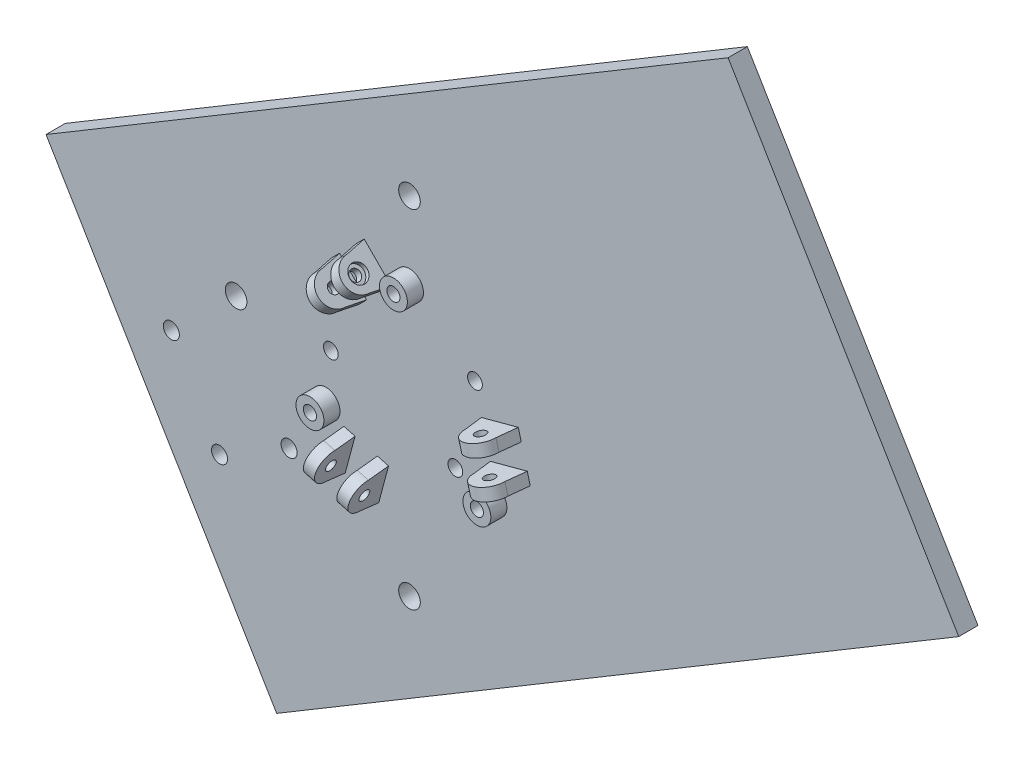
from build123d import *

# Parameters (mm, degrees)
F_01_START                                    = -12
S01_ROUNDED_V3_BACKPLATE_WITH_CAGE_AND_R      = 3.365102548
S01_ROUNDED_V3_BACKPLATE_WITH_CAGE_AND_R_2    = 2.294388101
F_01_ROUNDED_V3_BACKPLATE_WITH_CAGE_AND_DEPTH = 6
F_02_START                                    = -6
S02_THREE_CORD_GUIDE_PEDESTALS_R              = 4.35
F_02_THREE_CORD_GUIDE_PEDESTALS_DEPTH         = 5
F_03_START                                    = -13
S03_THREE_SMOOTH_GROMMET_SEATS_R              = 2.05
F_03_THREE_SMOOTH_GROMMET_SEATS_DEPTH         = 14
F_04_START                                    = -7.2
F_04_INTEGRAL_A1_FORK_CHEEK_L_DEPTH           = 3.6
F_05_START                                    = 3.6
F_05_INTEGRAL_A1_FORK_CHEEK_R_DEPTH           = 3.6
F_06_START                                    = -7.5
S06_A1_PIVOT_THROUGH_BOTH_CHEEKS_R            = 1.65
F_06_A1_PIVOT_THROUGH_BOTH_CHEEKS_DEPTH       = 15
F_07_START                                    = -7.3
S07_A1_RECESSED_PIVOT_SCREW_HEAD_R            = 2.7
F_07_A1_RECESSED_PIVOT_SCREW_HEAD_DEPTH       = 1.5
F_08_START                                    = -7.2
F_08_INTEGRAL_A2_FORK_CHEEK_L_DEPTH           = 3.6
F_09_START                                    = 3.6
F_09_INTEGRAL_A2_FORK_CHEEK_R_DEPTH           = 3.6
F_10_START                                    = -7.5
S10_A2_PIVOT_THROUGH_BOTH_CHEEKS_R            = 1.65
F_10_A2_PIVOT_THROUGH_BOTH_CHEEKS_DEPTH       = 15
F_11_START                                    = -7.3
S11_A2_RECESSED_PIVOT_SCREW_HEAD_R            = 2.7
F_11_A2_RECESSED_PIVOT_SCREW_HEAD_DEPTH       = 1.5
F_12_START                                    = -7.2
F_12_INTEGRAL_A3_FORK_CHEEK_L_DEPTH           = 3.6
F_13_START                                    = 3.6
F_13_INTEGRAL_A3_FORK_CHEEK_R_DEPTH           = 3.6
F_14_START                                    = -7.5
S14_A3_PIVOT_THROUGH_BOTH_CHEEKS_R            = 1.65
F_14_A3_PIVOT_THROUGH_BOTH_CHEEKS_DEPTH       = 15
F_15_START                                    = -7.3
S15_A3_RECESSED_PIVOT_SCREW_HEAD_R            = 2.7
F_15_A3_RECESSED_PIVOT_SCREW_HEAD_DEPTH       = 1.5
BOSS_EXTRUDE1_DEPTH                           = 20
CUT_EXTRUDE1_DEPTH                            = 235.034793049
CUT_EXTRUDE1_DEPTH_BACK                       = 235.034793049
SKETCH2_R                                     = 2.2
FILLET1_R                                     = 2
BOSS_EXTRUDE2_DEPTH                           = 10
CUT_EXTRUDE3_DEPTH                            = 224.142474253
CUT_EXTRUDE3_DEPTH_BACK                       = 224.142474253
SKETCH4_R                                     = 2.5


with BuildPart() as part:
    # S01 - Rounded V3 backplate with cage and cassette fixings → 01 - Rounded V3 backplate with cage and cassette fixings (new body)
    with BuildSketch(Plane.XY.offset(F_01_START)):
        Polygon((-113.163433478, 13.929728046), (41.356735424, 106.252625544), (99.189614728, 140.806684253), (170.996312782, 20.624330663), (113.163433478, -13.929728046), (-41.356735424, -106.252625544), align=None)
        with Locations((0, 54)):
            Circle(S01_ROUNDED_V3_BACKPLATE_WITH_CAGE_AND_R, mode=Mode.SUBTRACT)
        with Locations((-53.973473076, 0)):
            Circle(S01_ROUNDED_V3_BACKPLATE_WITH_CAGE_AND_R, mode=Mode.SUBTRACT)
        with Locations((0, -54)):
            Circle(S01_ROUNDED_V3_BACKPLATE_WITH_CAGE_AND_R, mode=Mode.SUBTRACT)
        with Locations((14.276192628, -12.236736538)):
            Circle(S01_ROUNDED_V3_BACKPLATE_WITH_CAGE_AND_R_2, mode=Mode.SUBTRACT)
        with Locations((20.394560897, 14.276192628)):
            Circle(S01_ROUNDED_V3_BACKPLATE_WITH_CAGE_AND_R_2, mode=Mode.SUBTRACT)
        with Locations((-24.473473076, 0)):
            Circle(S01_ROUNDED_V3_BACKPLATE_WITH_CAGE_AND_R_2, mode=Mode.SUBTRACT)
    extrude(amount=F_01_ROUNDED_V3_BACKPLATE_WITH_CAGE_AND_DEPTH)

    # S02 - Three cord guide pedestals → 02 - Three cord guide pedestals (add)
    with BuildSketch(Plane.XY.offset(F_02_START)):
        with Locations((25.980762114, -15)):
            Circle(S02_THREE_CORD_GUIDE_PEDESTALS_R)
        with Locations((0, 30)):
            Circle(S02_THREE_CORD_GUIDE_PEDESTALS_R)
        with Locations((-25.980762114, -15)):
            Circle(S02_THREE_CORD_GUIDE_PEDESTALS_R)
    extrude(amount=F_02_THREE_CORD_GUIDE_PEDESTALS_DEPTH)

    # S03 - Three smooth grommet seats → 03 - Three smooth grommet seats (cut)
    with BuildSketch(Plane.XY.offset(F_03_START)):
        with Locations((25.980762114, -15)):
            Circle(S03_THREE_SMOOTH_GROMMET_SEATS_R)
        with Locations((0, 30)):
            Circle(S03_THREE_SMOOTH_GROMMET_SEATS_R)
        with Locations((-25.980762114, -15)):
            Circle(S03_THREE_SMOOTH_GROMMET_SEATS_R)
    extrude(amount=F_03_THREE_SMOOTH_GROMMET_SEATS_DEPTH, mode=Mode.SUBTRACT)

    # S04 - Integral A1 fork cheek L → 04 - Integral A1 fork cheek L (add)
    with BuildSketch(Plane(origin=(2.009618943, -7.5, 0), x_dir=(0.9659258262890683, 0.25881904510252085, 0), z_dir=(-0.2588190451025208, 0.9659258262890682, 0)).offset(F_04_START)):
        with BuildLine():
            Line((35.077774789, 7), (22.877774789, 7))
            Line((22.877774789, 7), (24.027774789, 0))
            ThreePointArc((24.027774789, 0), (28.977774789, -4.95), (33.927774789, 0))
            Line((33.927774789, 0), (35.077774789, 7))
        make_face()
    extrude(amount=F_04_INTEGRAL_A1_FORK_CHEEK_L_DEPTH)

    # S05 - Integral A1 fork cheek R → 05 - Integral A1 fork cheek R (add)
    with BuildSketch(Plane(origin=(2.009618943, -7.5, 0), x_dir=(0.9659258262890683, 0.25881904510252085, 0), z_dir=(-0.2588190451025208, 0.9659258262890682, 0)).offset(F_05_START)):
        with BuildLine():
            Line((35.077774789, 7), (22.877774789, 7))
            Line((22.877774789, 7), (24.027774789, 0))
            ThreePointArc((24.027774789, 0), (28.977774789, -4.95), (33.927774789, 0))
            Line((33.927774789, 0), (35.077774789, 7))
        make_face()
    extrude(amount=F_05_INTEGRAL_A1_FORK_CHEEK_R_DEPTH)

    # S06 - A1 pivot through both cheeks → 06 - A1 pivot through both cheeks (cut)
    with BuildSketch(Plane(origin=(2.009618943, -7.5, 0), x_dir=(0.9659258262890683, 0.25881904510252085, 0), z_dir=(-0.2588190451025208, 0.9659258262890682, 0)).offset(F_06_START)):
        with Locations((28.977774789, 0)):
            Circle(S06_A1_PIVOT_THROUGH_BOTH_CHEEKS_R)
    extrude(amount=F_06_A1_PIVOT_THROUGH_BOTH_CHEEKS_DEPTH, mode=Mode.SUBTRACT)

    # S07 - A1 recessed pivot screw head → 07 - A1 recessed pivot screw head (cut)
    with BuildSketch(Plane(origin=(2.009618943, -7.5, 0), x_dir=(0.9659258262890683, 0.25881904510252085, 0), z_dir=(-0.2588190451025208, 0.9659258262890682, 0)).offset(F_07_START)):
        with Locations((28.977774789, 0)):
            Circle(S07_A1_RECESSED_PIVOT_SCREW_HEAD_R)
    extrude(amount=F_07_A1_RECESSED_PIVOT_SCREW_HEAD_DEPTH, mode=Mode.SUBTRACT)

    # S08 - Integral A2 fork cheek L → 08 - Integral A2 fork cheek L (add)
    with BuildSketch(Plane(origin=(5.490381057, 5.490381057, 0), x_dir=(-0.7071067811865475, 0.7071067811865477, 0), z_dir=(-0.7071067811865477, -0.7071067811865475, 0)).offset(F_08_START)):
        with BuildLine():
            Line((35.077774789, 7), (22.877774789, 7))
            Line((22.877774789, 7), (24.027774789, 0))
            ThreePointArc((24.027774789, 0), (28.977774789, -4.95), (33.927774789, 0))
            Line((33.927774789, 0), (35.077774789, 7))
        make_face()
    extrude(amount=F_08_INTEGRAL_A2_FORK_CHEEK_L_DEPTH)

    # S09 - Integral A2 fork cheek R → 09 - Integral A2 fork cheek R (add)
    with BuildSketch(Plane(origin=(5.490381057, 5.490381057, 0), x_dir=(-0.7071067811865475, 0.7071067811865477, 0), z_dir=(-0.7071067811865477, -0.7071067811865475, 0)).offset(F_09_START)):
        with BuildLine():
            Line((35.077774789, 7), (22.877774789, 7))
            Line((22.877774789, 7), (24.027774789, 0))
            ThreePointArc((24.027774789, 0), (28.977774789, -4.95), (33.927774789, 0))
            Line((33.927774789, 0), (35.077774789, 7))
        make_face()
    extrude(amount=F_09_INTEGRAL_A2_FORK_CHEEK_R_DEPTH)

    # S10 - A2 pivot through both cheeks → 10 - A2 pivot through both cheeks (cut)
    with BuildSketch(Plane(origin=(5.490381057, 5.490381057, 0), x_dir=(-0.7071067811865475, 0.7071067811865477, 0), z_dir=(-0.7071067811865477, -0.7071067811865475, 0)).offset(F_10_START)):
        with Locations((28.977774789, 0)):
            Circle(S10_A2_PIVOT_THROUGH_BOTH_CHEEKS_R)
    extrude(amount=F_10_A2_PIVOT_THROUGH_BOTH_CHEEKS_DEPTH, mode=Mode.SUBTRACT)

    # S11 - A2 recessed pivot screw head → 11 - A2 recessed pivot screw head (cut)
    with BuildSketch(Plane(origin=(5.490381057, 5.490381057, 0), x_dir=(-0.7071067811865475, 0.7071067811865477, 0), z_dir=(-0.7071067811865477, -0.7071067811865475, 0)).offset(F_11_START)):
        with Locations((28.977774789, 0)):
            Circle(S11_A2_RECESSED_PIVOT_SCREW_HEAD_R)
    extrude(amount=F_11_A2_RECESSED_PIVOT_SCREW_HEAD_DEPTH, mode=Mode.SUBTRACT)

    # S12 - Integral A3 fork cheek L → 12 - Integral A3 fork cheek L (add)
    with BuildSketch(Plane(origin=(-7.5, 2.009618943, 0), x_dir=(0, 0, -1), z_dir=(0.9659258262890683, -0.25881904510252113, 0)).offset(F_12_START)):
        with BuildLine():
            Line((7, -35.077774789), (7, -22.877774789))
            Line((7, -22.877774789), (0, -24.027774789))
            ThreePointArc((0, -24.027774789), (-4.95, -28.977774789), (0, -33.927774789))
            Line((0, -33.927774789), (7, -35.077774789))
        make_face()
    extrude(amount=F_12_INTEGRAL_A3_FORK_CHEEK_L_DEPTH)

    # S13 - Integral A3 fork cheek R → 13 - Integral A3 fork cheek R (add)
    with BuildSketch(Plane(origin=(-7.5, 2.009618943, 0), x_dir=(0, 0, -1), z_dir=(0.9659258262890683, -0.25881904510252113, 0)).offset(F_13_START)):
        with BuildLine():
            Line((7, -35.077774789), (7, -22.877774789))
            Line((7, -22.877774789), (0, -24.027774789))
            ThreePointArc((0, -24.027774789), (-4.95, -28.977774789), (0, -33.927774789))
            Line((0, -33.927774789), (7, -35.077774789))
        make_face()
    extrude(amount=F_13_INTEGRAL_A3_FORK_CHEEK_R_DEPTH)

    # S14 - A3 pivot through both cheeks → 14 - A3 pivot through both cheeks (cut)
    with BuildSketch(Plane(origin=(-7.5, 2.009618943, 0), x_dir=(0, 0, -1), z_dir=(0.9659258262890683, -0.25881904510252113, 0)).offset(F_14_START)):
        with Locations((0, -28.977774789)):
            Circle(S14_A3_PIVOT_THROUGH_BOTH_CHEEKS_R)
    extrude(amount=F_14_A3_PIVOT_THROUGH_BOTH_CHEEKS_DEPTH, mode=Mode.SUBTRACT)

    # S15 - A3 recessed pivot screw head → 15 - A3 recessed pivot screw head (cut)
    with BuildSketch(Plane(origin=(-7.5, 2.009618943, 0), x_dir=(0, 0, -1), z_dir=(0.9659258262890683, -0.25881904510252113, 0)).offset(F_15_START)):
        with Locations((0, -28.977774789)):
            Circle(S15_A3_RECESSED_PIVOT_SCREW_HEAD_R)
    extrude(amount=F_15_A3_RECESSED_PIVOT_SCREW_HEAD_DEPTH, mode=Mode.SUBTRACT)

    # Sketch1 → Boss-Extrude1 (add)
    with BuildSketch(Plane(origin=(0, 0, -12), x_dir=(-1, 0, 0), z_dir=(0, 0, -1))):
        Polygon((-18.800374151, 31.61679677), (-16.800374151, 35.080898385), (-8.140120113, 30.080898385), (-10.140120113, 26.61679677), align=None)
        Polygon((7.180387963, -13.38320323), (9.180387963, -9.919101615), (17.840642001, -14.919101615), (15.840642001, -18.38320323), align=None)
        Polygon((15.180387963, 0.47320323), (23.840642001, -4.52679677), (21.840642001, -7.990898385), (13.180387963, -2.990898385), align=None)
        Polygon((-44.781136264, -13.38320323), (-42.781136264, -9.919101615), (-34.120882226, -14.919101615), (-36.120882226, -18.38320323), align=None)
        Polygon((-36.781136264, 0.47320323), (-28.120882226, -4.52679677), (-30.120882226, -7.990898385), (-38.781136264, -2.990898385), align=None)
        Polygon((-10.800374151, 45.47320323), (-2.140120113, 40.47320323), (-4.140120113, 37.009101615), (-12.800374151, 42.009101615), align=None)
    extrude(amount=BOSS_EXTRUDE1_DEPTH)

    # Sketch2 → Cut-Extrude1 (cut, two sides: drawn at the far end of the back side and taken through both)
    with BuildSketch(Plane(origin=(-16.990381057, 29.42820323, 0), x_dir=(0.866025403784439, 0.4999999999999995, 0), z_dir=(-0.4999999999999995, 0.866025403784439, 0)).offset(-CUT_EXTRUDE1_DEPTH_BACK)):
        with Locations((27.09, 27)):
            Circle(SKETCH2_R)
        with Locations((-17.91, 27)):
            Circle(SKETCH2_R)
    extrude(amount=CUT_EXTRUDE1_DEPTH + CUT_EXTRUDE1_DEPTH_BACK, mode=Mode.SUBTRACT)

    # Fillet1
    fillet1_edges = [part.edges().sort_by_distance(p)[0] for p in [
        (43.781136264, -11.651152423, -32),
        (35.120882226, -16.651152423, -32),
        (29.120882226, -6.258847577, -32),
        (37.781136264, -1.258847577, -32),
        (9.140120113, 28.348847577, -32),
        (17.800374151, 33.348847577, -32),
        (11.800374151, 43.741152423, -32),
        (3.140120113, 38.741152423, -32),
        (-8.180387963, -11.651152423, -32),
        (-16.840642001, -16.651152423, -32),
        (-14.180387963, -1.258847577, -32),
        (-22.840642001, -6.258847577, -32),
    ]]
    fillet(fillet1_edges, radius=FILLET1_R)

    # Sketch3 → Boss-Extrude2 (add)
    with BuildSketch(Plane(origin=(0, 0, -12), x_dir=(-1, 0, 0), z_dir=(0, 0, -1))):
        Polygon((24.960851173, -38.572695095), (59.601867324, -58.572695095), (84.601867324, -15.271424906), (49.960851173, 4.728575094), align=None)
    extrude(amount=BOSS_EXTRUDE2_DEPTH)

    # Sketch4 → Cut-Extrude3 (cut, two sides: drawn at the far end of the back side and taken through both)
    with BuildSketch(Plane(origin=(0, 0, -22), x_dir=(-1, 0, 0), z_dir=(0, 0, -1)).offset(-CUT_EXTRUDE3_DEPTH_BACK)):
        with Locations((74.138509531, -19.363467506)):
            Circle(SKETCH4_R)
        with Locations((59.138509531, -45.344229619)):
            Circle(SKETCH4_R)
        with Locations((37.487874436, -32.844229619)):
            Circle(SKETCH4_R)
    extrude(amount=CUT_EXTRUDE3_DEPTH + CUT_EXTRUDE3_DEPTH_BACK, mode=Mode.SUBTRACT)


solid = part.part
